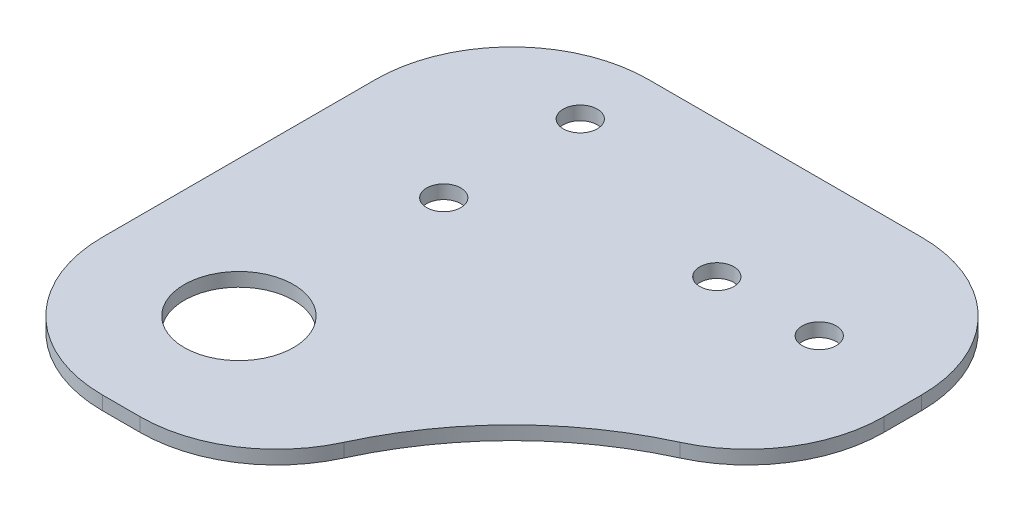
from build123d import *

# Parameters (mm, degrees)
SKETCH1_R           = 2.5
SKETCH1_W           = 40
SKETCH1_H           = 40
SKETCH1_R_2         = 8
BOSS_EXTRUDE1_DEPTH = 2
FILLET1_R           = 50
FILLET2_R           = 20


with BuildPart() as part:
    # Sketch1 → Boss-Extrude1 (new body)
    # profile 1 of 2: a face of its own
    with BuildSketch(Plane(origin=(0, 0, 0), x_dir=(1, 0, 0), z_dir=(0, 1, 0))):
        Polygon((80, 0), (80, 40), (0, 40), (0, 0), (40, 0), align=None)
        with Locations(Location((20, 10, 0), (0, 0, 270))):
            Circle(SKETCH1_R, mode=Mode.SUBTRACT)
        with Locations(Location((20, 30, 0), (0, 0, 270))):
            Circle(SKETCH1_R, mode=Mode.SUBTRACT)
        with Locations(Location((50, 20, 0), (0, 0, 270))):
            Circle(SKETCH1_R, mode=Mode.SUBTRACT)
        with Locations(Location((65, 20, 0), (0, 0, 270))):
            Circle(SKETCH1_R, mode=Mode.SUBTRACT)
    # profile 2 of 2: a face of its own
    with BuildSketch(Plane(origin=(0, 0, 0), x_dir=(1, 0, 0), z_dir=(0, 1, 0))):
        with Locations((20, -20)):
            Rectangle(SKETCH1_W, SKETCH1_H)
        with Locations(Location((20, -20, 0), (0, 0, 270))):
            Circle(SKETCH1_R_2, mode=Mode.SUBTRACT)
    extrude(amount=BOSS_EXTRUDE1_DEPTH)

    # Fillet1
    # the kernel refuses this fillet: 50 mm, written as the material it adds along each edge
    with BuildSketch(Plane(origin=(40, 0, 0), x_dir=(0, 0, 1), z_dir=(0, 1, 0))) as fillet1_piece_1:
        with BuildLine():
            CenterArc((49.154759474, 49.154759474), FILLET1_R, 190.550098012, 68.899803976)
            Line((0, 40), (0, 0))
            Line((0, 0), (40, 0))
        make_face()
    extrude(amount=2)

    # Fillet2
    fillet2_edges = [part.edges().sort_by_distance(p)[0] for p in [
        (80, 1, -40),
        (80, 1, 0),
        (40, 1, 40),
        (0, 1, 40),
        (0, 1, -40),
    ]]
    fillet(fillet2_edges, radius=FILLET2_R)


solid = part.part
